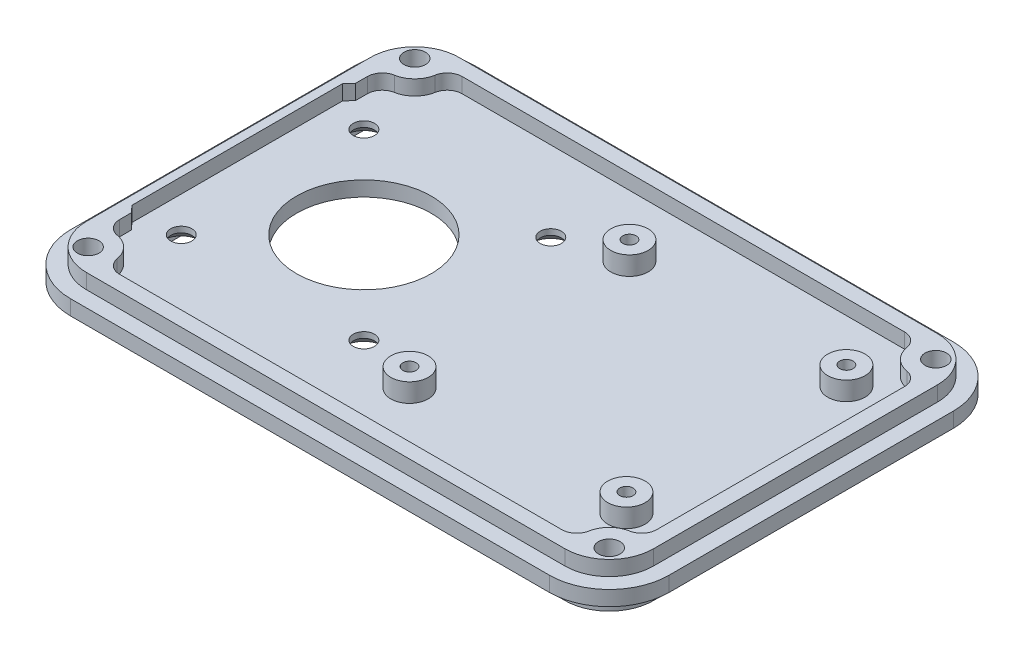
from build123d import *

# Parameters (mm, degrees)
BOSS_EXTRUDE1_DEPTH           = 2.54
BOSS_EXTRUDE2_DEPTH           = 2.54
BOSS_EXTRUDE2_DEPTH_BACK      = 5.08
HOLE1_OUTLINE_R               = 11.43
HOLE1_DEPTH                   = 2.54
CSK_FOR_M3_SFHCS1_D           = 3.6
CSK_FOR_M3_SFHCS1_CSINK_D     = 6.72
CSK_FOR_M3_SFHCS1_CSINK_ANGLE = 90
SKETCH9_W                     = 1.8288
SKETCH9_H                     = 5.08
F_6_CLEARANCE_HOLE_AT_2_COUNT = 2
F_6_CLEARANCE_HOLE_AT_2_PITCH = 55.444204897
F_6_CLEARANCE_HOLE_AT_3_COUNT = 2
F_6_CLEARANCE_HOLE_AT_3_PITCH = 104.402947299
F_6_CLEARANCE_HOLE_AT_4_COUNT = 2
F_6_CLEARANCE_HOLE_AT_4_PITCH = 88.464204897
BOSS_EXTRUDE4_START           = -5.08
SKETCH10_R                    = 1.8288
BOSS_EXTRUDE4_DEPTH           = 7.62
FILLET4_R                     = 2.54
SKETCH11_R                    = 3.175
BOSS_EXTRUDE5_DEPTH           = 3.175
TAP_DRILL_FOR_4_40_TAP1_D     = 2.2606
TAP_DRILL_FOR_4_40_TAP1_DEPTH = 5.08
TAP_DRILL_FOR_4_40_TAP1_TIP   = 0.679152758
SKETCH14_R                    = 1.8288
CUT_EXTRUDE1_DEPTH            = 62.843262568
CUT_EXTRUDE2_DEPTH            = 62.500004065


# Read off the part's stored shape, not the designer's step: Hole1
with BuildPart() as part:
    # Sketch1 → Boss-Extrude1 (new body)
    with BuildSketch(Plane(origin=(0, 0, 0), x_dir=(1, 0, 0), z_dir=(0, 1, 0))):
        with BuildLine():
            Line((40.64, -34.29), (-40.64, -34.29))
            ThreePointArc((-40.64, -34.29), (-47.824204897, -31.314204897), (-50.8, -24.13))
            Line((-50.8, -24.13), (-50.8, 24.13))
            ThreePointArc((-50.8, 24.13), (-47.824204897, 31.314204897), (-40.64, 34.29))
            Line((-40.64, 34.29), (40.64, 34.29))
            ThreePointArc((40.64, 34.29), (47.824204897, 31.314204897), (50.8, 24.13))
            Line((50.8, 24.13), (50.8, -24.13))
            ThreePointArc((50.8, -24.13), (47.824204897, -31.314204897), (40.64, -34.29))
        make_face()
    extrude(amount=BOSS_EXTRUDE1_DEPTH)

    # Sketch2 → Boss-Extrude2 (add, two sides: drawn at the far end of the back side and taken through both)
    with BuildSketch(Plane.XZ.offset(-BOSS_EXTRUDE2_DEPTH_BACK)):
        with BuildLine():
            Line((48.133, -24.13), (48.133, 24.13))
            ThreePointArc((48.133, 24.13), (45.938351111, 29.428351111), (40.64, 31.623))
            Line((40.64, 31.623), (-40.64, 31.623))
            ThreePointArc((-40.64, 31.623), (-45.938351111, 29.428351111), (-48.133, 24.13))
            Line((-48.133, 24.13), (-48.133, -24.13))
            ThreePointArc((-48.133, -24.13), (-45.938351111, -29.428351111), (-40.64, -31.623))
            Line((-40.64, -31.623), (40.64, -31.623))
            ThreePointArc((40.64, -31.623), (45.938351111, -29.428351111), (48.133, -24.13))
        make_face()
        with BuildLine():
            Line((45.593, -24.13), (45.593, 24.13))
            ThreePointArc((45.593, 24.13), (44.142299887, 27.632299887), (40.64, 29.083))
            Line((40.64, 29.083), (-40.64, 29.083))
            ThreePointArc((-40.64, 29.083), (-44.142299887, 27.632299887), (-45.593, 24.13))
            Line((-45.593, 24.13), (-45.593, -24.13))
            ThreePointArc((-45.593, -24.13), (-44.142299887, -27.632299887), (-40.64, -29.083))
            Line((-40.64, -29.083), (40.64, -29.083))
            ThreePointArc((40.64, -29.083), (44.142299887, -27.632299887), (45.593, -24.13))
        make_face(mode=Mode.SUBTRACT)
    extrude(amount=BOSS_EXTRUDE2_DEPTH + BOSS_EXTRUDE2_DEPTH_BACK)

    # Hole1 outline → Hole1 (cut)
    with BuildSketch(Plane(origin=(0, 0, 0), x_dir=(1, 0, 0), z_dir=(0, 1, 0))):
        with Locations((-25.146, 0)):
            Circle(HOLE1_OUTLINE_R)
    extrude(amount=HOLE1_DEPTH, mode=Mode.SUBTRACT)

    # CSK for M3 SFHCS1 (through all)
    with Locations(Plane(origin=(48.934573601, 0, -16.825198342), x_dir=(0, 0, 1), z_dir=(0, -1, 0))):
        with Locations((32.325198342, 89.580573601), (1.325198342, 89.580573601), (1.325198342, 57.850841183), (32.325198342, 58.580573601)):
            CounterSinkHole(CSK_FOR_M3_SFHCS1_D / 2, CSK_FOR_M3_SFHCS1_CSINK_D / 2, counter_sink_angle=CSK_FOR_M3_SFHCS1_CSINK_ANGLE)

    # Sketch9 → #6 Clearance Hole (revolve, cut)
    with BuildSketch(Plane(origin=(44.232102448, 2.54, -27.722102448), x_dir=(0, 0, 1), z_dir=(1, 0, 0))):
        with Locations((0.9144, 2.54)):
            Rectangle(SKETCH9_W, SKETCH9_H)
    f_6_clearance_hole = revolve(axis=Axis((44.232102448, 8.89, -27.722102448), (0, -1, 0)), mode=Mode.SUBTRACT)

    # #6 Clearance Hole at 2: #6 Clearance Hole ×2
    with Locations(*[(0, 0, i * F_6_CLEARANCE_HOLE_AT_2_PITCH) for i in range(1, F_6_CLEARANCE_HOLE_AT_2_COUNT)]):
        add(f_6_clearance_hole, mode=Mode.SUBTRACT)

    # #6 Clearance Hole at 3: #6 Clearance Hole ×2
    with Locations(*[Vector(-0.8473343634990179, 0, 0.5310597672896286) * (i * F_6_CLEARANCE_HOLE_AT_3_PITCH) for i in range(1, F_6_CLEARANCE_HOLE_AT_3_COUNT)]):
        add(f_6_clearance_hole, mode=Mode.SUBTRACT)

    # #6 Clearance Hole at 4: #6 Clearance Hole ×2
    with Locations(*[(-i * F_6_CLEARANCE_HOLE_AT_4_PITCH, 0, 0) for i in range(1, F_6_CLEARANCE_HOLE_AT_4_COUNT)]):
        add(f_6_clearance_hole, mode=Mode.SUBTRACT)

    # Sketch10 → Boss-Extrude4 (add)
    # profile 1 of 4: a face of its own
    with BuildSketch(Plane.XZ.offset(BOSS_EXTRUDE4_START)):
        with BuildLine():
            ThreePointArc((-42.196740764, 31.45950252), (-45.938351111, 29.428351111), (-47.96950252, 25.686740764))
            ThreePointArc((-47.96950252, 25.686740764), (-41.222878588, 24.712878588), (-42.196740764, 31.45950252))
        make_face()
        with Locations(Location((-44.232102448, 27.722102448, 0), (0, 0, 90))):
            Circle(SKETCH10_R, mode=Mode.SUBTRACT)
    # profile 2 of 4: a face of its own
    with BuildSketch(Plane.XZ.offset(BOSS_EXTRUDE4_START)):
        with BuildLine():
            ThreePointArc((47.96950252, 25.686740764), (41.222878588, 24.712878588), (42.196740764, 31.45950252))
            ThreePointArc((42.196740764, 31.45950252), (45.938351111, 29.428351111), (47.96950252, 25.686740764))
        make_face()
        with Locations(Location((44.232102448, 27.722102448, 0), (0, 0, 90))):
            Circle(SKETCH10_R, mode=Mode.SUBTRACT)
    # profile 3 of 4: a face of its own
    with BuildSketch(Plane.XZ.offset(BOSS_EXTRUDE4_START)):
        with BuildLine():
            ThreePointArc((42.196740764, -31.45950252), (45.938351111, -29.428351111), (47.96950252, -25.686740764))
            ThreePointArc((47.96950252, -25.686740764), (41.222878588, -24.712878588), (42.196740764, -31.45950252))
        make_face()
        with Locations(Location((44.232102448, -27.722102448, 0), (0, 0, 90))):
            Circle(SKETCH10_R, mode=Mode.SUBTRACT)
    # profile 4 of 4: a face of its own
    with BuildSketch(Plane.XZ.offset(BOSS_EXTRUDE4_START)):
        with BuildLine():
            ThreePointArc((-47.96950252, -25.686740764), (-41.222878588, -24.712878588), (-42.196740764, -31.45950252))
            ThreePointArc((-42.196740764, -31.45950252), (-45.938351111, -29.428351111), (-47.96950252, -25.686740764))
        make_face()
        with Locations(Location((-44.232102448, -27.722102448, 0), (0, 0, 90))):
            Circle(SKETCH10_R, mode=Mode.SUBTRACT)
    extrude(amount=BOSS_EXTRUDE4_DEPTH)

    # Fillet4
    fillet4_edges = [part.edges().sort_by_distance(p)[0] for p in [
        (-40.199880439, 3.81, 29.083),
        (-45.593, 3.81, 23.689880439),
        (-45.593, -1.27, 23.689880439),
        (-40.199880439, -1.27, 29.083),
        (40.199880439, -1.27, 29.083),
        (45.593, -1.27, 23.689880439),
        (40.199880439, 3.81, 29.083),
        (45.593, 3.81, 23.689880439),
        (45.593, -1.27, -23.689880439),
        (40.199880439, -1.27, -29.083),
        (45.593, 3.81, -23.689880439),
        (40.199880439, 3.81, -29.083),
        (-40.199880439, -1.27, -29.083),
        (-45.593, -1.27, -23.689880439),
        (-40.199880439, 3.81, -29.083),
        (-45.593, 3.81, -23.689880439),
    ]]
    fillet(fillet4_edges, radius=FILLET4_R)

    # Sketch11 → Boss-Extrude5 (add)
    with BuildSketch(Plane(origin=(0, 2.54, 0), x_dir=(1, 0, 0), z_dir=(0, 1, 0))):
        with Locations(Location((38.1, 18.669, 0), (0, 0, 90))):
            Circle(SKETCH11_R)
        with Locations(Location((1.27, 18.669, 0), (0, 0, 90))):
            Circle(SKETCH11_R)
        with Locations(Location((1.27, -18.669, 0), (0, 0, 90))):
            Circle(SKETCH11_R)
        with Locations(Location((38.1, -18.669, 0), (0, 0, 90))):
            Circle(SKETCH11_R)
    extrude(amount=BOSS_EXTRUDE5_DEPTH)

    # Tap Drill for #4-40 Tap1
    with Locations(Plane(origin=(0, 5.715, 0), x_dir=(1, 0, 0), z_dir=(0, 1, 0))):
        with Locations((38.1, 18.669), (1.27, 18.669), (1.27, -18.669), (38.1, -18.669)):
            Hole(TAP_DRILL_FOR_4_40_TAP1_D / 2, depth=TAP_DRILL_FOR_4_40_TAP1_DEPTH)
            with Locations((0, 0, -(TAP_DRILL_FOR_4_40_TAP1_DEPTH + TAP_DRILL_FOR_4_40_TAP1_TIP / 2))):  # 118° drill point
                Cone(0, TAP_DRILL_FOR_4_40_TAP1_D / 2, TAP_DRILL_FOR_4_40_TAP1_TIP, mode=Mode.SUBTRACT)

    # Sketch14 → Cut-Extrude1 (cut, through all)
    with BuildSketch(Plane.XZ.offset(2.54)):
        with Locations(Location((44.232102448, -27.722102448, 0), (0, 0, 90))):
            Circle(SKETCH14_R)
        with Locations(Location((-44.232102448, -27.722102448, 0), (0, 0, 90))):
            Circle(SKETCH14_R)
        with Locations(Location((-44.232102448, 27.722102448, 0), (0, 0, 90))):
            Circle(SKETCH14_R)
        with Locations(Location((44.232102448, 27.722102448, 0), (0, 0, 90))):
            Circle(SKETCH14_R)
    extrude(amount=-CUT_EXTRUDE1_DEPTH, mode=Mode.SUBTRACT)

    # Sketch15 → Cut-Extrude2 (cut, through all)
    with BuildSketch(Plane(origin=(0, 2.54, 0), x_dir=(1, 0, 0), z_dir=(0, 1, 0))):
        with BuildLine():
            Line((-42.989587083, -21.5), (-7.302412917, -21.5))
            ThreePointArc((-7.302412917, -21.5), (-5.389436534, -19.756563466), (-3.646, -17.843587083))
            Line((-3.646, -17.843587083), (-3.646, 17.843587083))
            ThreePointArc((-3.646, 17.843587083), (-5.389436534, 19.756563466), (-7.302412917, 21.5))
            Line((-7.302412917, 21.5), (-42.989587083, 21.5))
            ThreePointArc((-42.989587083, 21.5), (-44.902563466, 19.756563466), (-46.646, 17.843587083))
            Line((-46.646, 17.843587083), (-46.646, -17.843587083))
            ThreePointArc((-46.646, -17.843587083), (-44.902563466, -19.756563466), (-42.989587083, -21.5))
        make_face()
    extrude(amount=CUT_EXTRUDE2_DEPTH, mode=Mode.SUBTRACT)


solid = part.part
